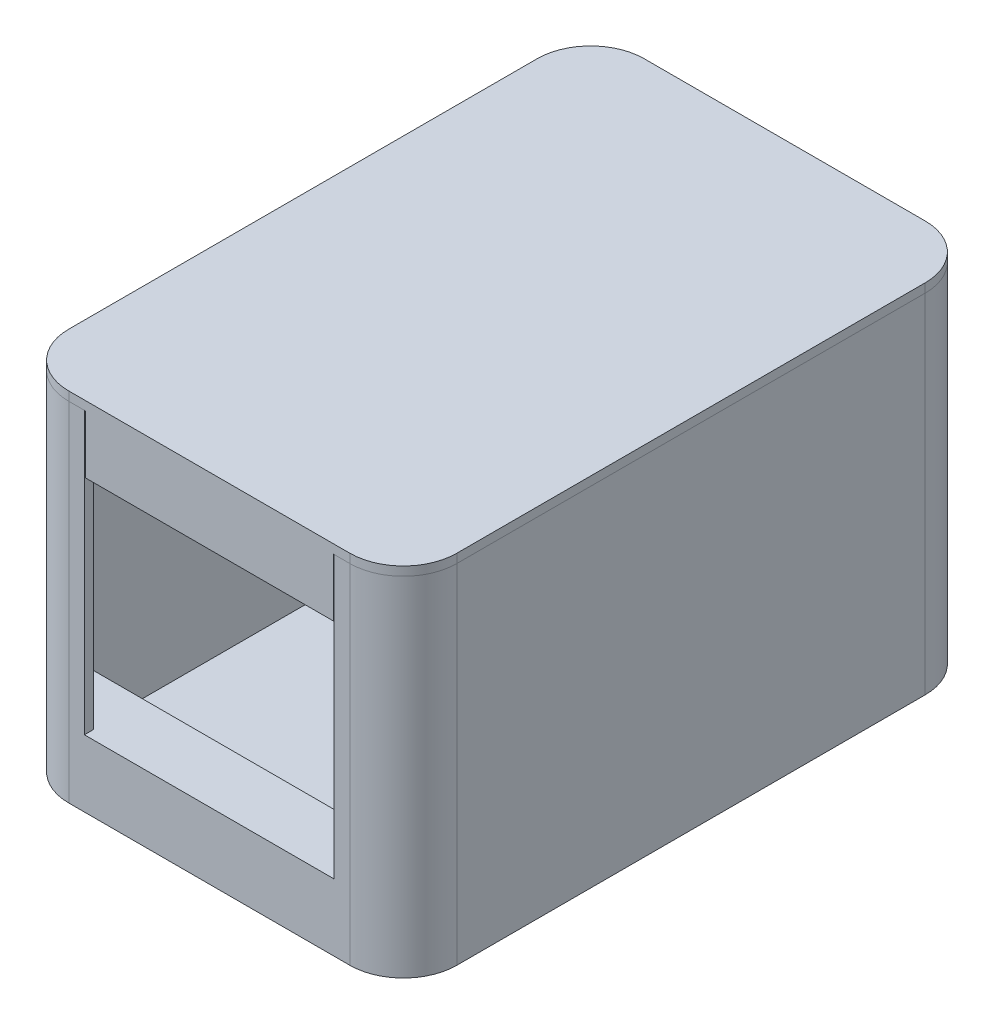
from build123d import *

# Parameters (mm, degrees)
BOSS_EXTRUDE1_DEPTH = 80
SHELL1_T            = -2
SKETCH2_W           = 83
SKETCH2_H           = 1.5
BOSS_EXTRUDE2_DEPTH = 13
SKETCH4_W           = 55.6
SKETCH4_H           = 2
BOSS_EXTRUDE3_DEPTH = 13
CHAMFER1_SIZE       = 1
SKETCH3_W           = 56
SKETCH3_H           = 63
CUT_EXTRUDE1_DEPTH  = 158.902659889
CHAMFER2_SIZE       = 1


with BuildPart() as part:
    # Sketch1 → Boss-Extrude1 (new body)
    with BuildSketch(Plane(origin=(0, 0, 0), x_dir=(1, 0, 0), z_dir=(0, 1, 0))):
        with BuildLine():
            Line((43.5, 52.5), (43.5, -52.5))
            ThreePointArc((43.5, -52.5), (39.985281374, -60.985281374), (31.5, -64.5))
            Line((31.5, -64.5), (-31.5, -64.5))
            ThreePointArc((-31.5, -64.5), (-39.985281374, -60.985281374), (-43.5, -52.5))
            Line((-43.5, -52.5), (-43.5, 52.5))
            ThreePointArc((-43.5, 52.5), (-39.985281374, 60.985281374), (-31.5, 64.5))
            Line((-31.5, 64.5), (31.5, 64.5))
            ThreePointArc((31.5, 64.5), (39.985281374, 60.985281374), (43.5, 52.5))
        make_face()
    extrude(amount=BOSS_EXTRUDE1_DEPTH)


with BuildPart() as body_2:
    # Split1: the piece on the far side of the plane
    add(part.part)
    split(bisect_by=Plane.ZX.offset(78), keep=Keep.BOTTOM)

    # Shell1
    shell1_openings = [body_2.faces().sort_by_distance(p)[0] for p in [
        (0, 78, 0),
    ]]
    offset(amount=SHELL1_T, openings=shell1_openings, kind=Kind.INTERSECTION)

    # Sketch2 → Boss-Extrude2 (add)
    with BuildSketch(Plane(origin=(0, 2, 0), x_dir=(1, 0, 0), z_dir=(0, 1, 0))):
        with Locations((0, 51.75)):
            Rectangle(SKETCH2_W, SKETCH2_H)
        with BuildLine():
            Line((-41.5, 52.5), (41.5, 52.5))
            ThreePointArc((41.5, 52.5), (38.571067812, 59.571067812), (31.5, 62.5))
            Line((31.5, 62.5), (-31.5, 62.5))
            ThreePointArc((-31.5, 62.5), (-38.571067812, 59.571067812), (-41.5, 52.5))
        make_face()
        with BuildLine():
            Line((-41.5, -52.5), (41.5, -52.5))
            ThreePointArc((41.5, -52.5), (38.571067812, -59.571067812), (31.5, -62.5))
            Line((31.5, -62.5), (-31.5, -62.5))
            ThreePointArc((-31.5, -62.5), (-38.571067812, -59.571067812), (-41.5, -52.5))
        make_face()
        with Locations((0, -51.75)):
            Rectangle(SKETCH2_W, SKETCH2_H)
    extrude(amount=BOSS_EXTRUDE2_DEPTH)

    # Sketch3 → Cut-Extrude1 (cut, through all)
    with BuildSketch(Plane.XY.offset(64.5)):
        with Locations((0, 46.5)):
            Rectangle(SKETCH3_W, SKETCH3_H)
    extrude(amount=-CUT_EXTRUDE1_DEPTH, mode=Mode.SUBTRACT)

    # Chamfer2
    chamfer2_edges = [body_2.edges().sort_by_distance(p)[0] for p in [
        (41.5, 78, 0),
        (38.571067812, 78, -59.571067812),
        (29.75, 78, -62.5),
        (-38.571067812, 78, -59.571067812),
        (-41.5, 78, 0),
        (-38.571067812, 78, 59.571067812),
        (-29.75, 78, 62.5),
        (38.571067812, 78, 59.571067812),
        (29.75, 78, 62.5),
        (-29.75, 78, -62.5),
    ]]
    chamfer(chamfer2_edges, length=CHAMFER2_SIZE)


with BuildPart() as part_1:
    add(part.part)

    # Split1
    split(bisect_by=Plane.ZX.offset(78), keep=Keep.TOP)

    # Sketch4 → Boss-Extrude3 (add)
    # profile 1 of 3: a face of its own
    with BuildSketch(Plane.XZ.offset(-78)):
        with BuildLine():
            Line((31.5, -62.5), (-31.5, -62.5))
            ThreePointArc((-31.5, -62.5), (-38.571067812, -59.571067812), (-41.5, -52.5))
            Line((-41.5, -52.5), (-41.5, 52.5))
            ThreePointArc((-41.5, 52.5), (-38.571067812, 59.571067812), (-31.5, 62.5))
            Line((-31.5, 62.5), (31.5, 62.5))
            ThreePointArc((31.5, 62.5), (38.571067812, 59.571067812), (41.5, 52.5))
            Line((41.5, 52.5), (41.5, -52.5))
            ThreePointArc((41.5, -52.5), (38.571067812, -59.571067812), (31.5, -62.5))
        make_face()
        with BuildLine():
            ThreePointArc((39.5, 52.5), (37.156854249, 58.156854249), (31.5, 60.5))
            Line((31.5, 60.5), (-31.5, 60.5))
            ThreePointArc((-31.5, 60.5), (-37.156854249, 58.156854249), (-39.5, 52.5))
            Line((-39.5, 52.5), (-39.5, -52.5))
            ThreePointArc((-39.5, -52.5), (-37.156854249, -58.156854249), (-31.5, -60.5))
            Line((-31.5, -60.5), (31.5, -60.5))
            ThreePointArc((31.5, -60.5), (37.156854249, -58.156854249), (39.5, -52.5))
            Line((39.5, -52.5), (39.5, 52.5))
        make_face(mode=Mode.SUBTRACT)
    # profile 2 of 3: a face of its own
    with BuildSketch(Plane.XZ.offset(-78)):
        with Locations((0, 63.5)):
            Rectangle(SKETCH4_W, SKETCH4_H)
    # profile 3 of 3: a face of its own
    with BuildSketch(Plane.XZ.offset(-78)):
        with Locations((0, -63.5)):
            Rectangle(SKETCH4_W, SKETCH4_H)
    extrude(amount=BOSS_EXTRUDE3_DEPTH)

    # Chamfer1
    chamfer1_edges = [part_1.edges().sort_by_distance(p)[0] for p in [
        (29.65, 65, -62.5),
        (41.5, 65, 0),
        (29.65, 65, 62.5),
        (-29.65, 65, 62.5),
        (-41.5, 65, 0),
        (-29.65, 65, -62.5),
        (38.571067812, 65, -59.571067812),
        (38.571067812, 65, 59.571067812),
        (-38.571067812, 65, 59.571067812),
        (-38.571067812, 65, -59.571067812),
    ]]
    chamfer(chamfer1_edges, length=CHAMFER1_SIZE)


solid = Compound([body_2.part, part_1.part])
